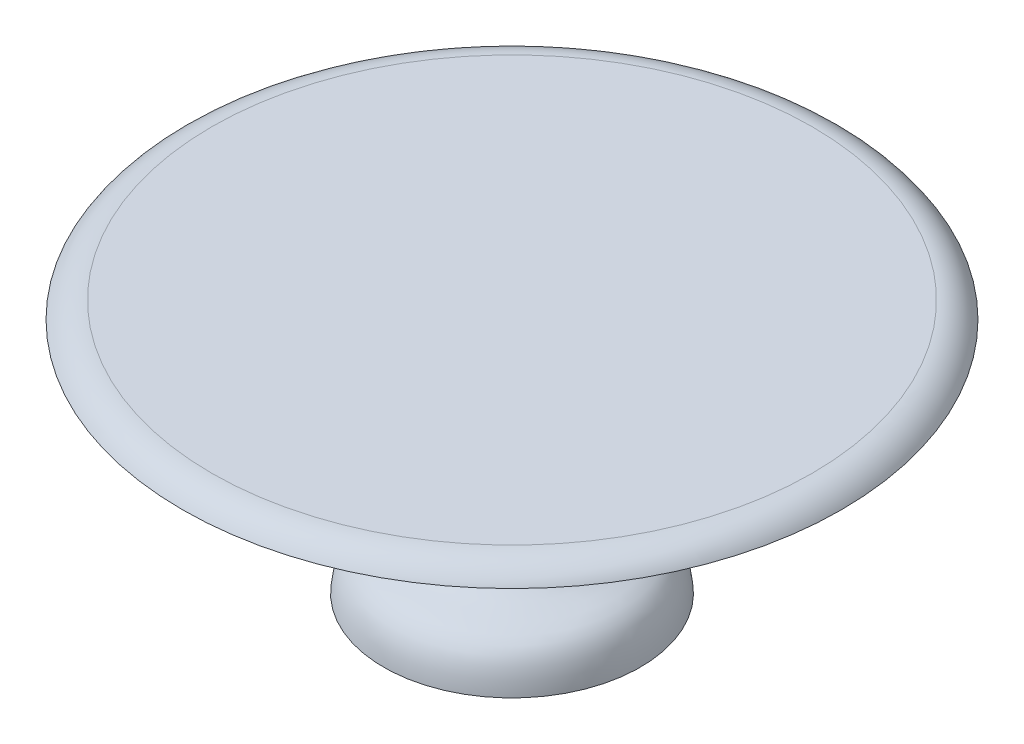
from build123d import *

# Parameters (mm, degrees)
FILLET_1_R = 2


with BuildPart() as part:
    # 草圖2 → 旋轉1 (revolve)
    with BuildSketch(Plane.XY, mode=Mode.PRIVATE) as revolve_1_sk:
        with BuildLine():
            Line((0, 15), (-20, 15))
            Line((-20, 15), (-19.466413941, 14))
            Line((-19.466413941, 14), (-4.949295137, 14))
            add(Edge.make_bspline(
                [(-4.949295137, 14), (-3.439519694, 11.708700289), (-13.638346404, 2.456724966), (-0.305701545, 11.860569474), (-3.888383363, 1.643920034), (-7.332063334, 3.055405181), (-7.582582315, 0)],
                knots=[0, 0, 0, 0, 0.345471571, 0.594733291, 0.813463418, 1, 1, 1, 1], degree=3))
            Line((-7.582582315, 0), (0, 0))
            Line((0, 0), (0, 15))
        make_face()
    revolve(revolve_1_sk.sketch.rotate(Axis((0, 0, 0), (0, 1, 0)), 270), axis=Axis((0, 0, 0), (0, 1, 0)))

    # 圓角1
    # the kernel refuses this fillet: 2 mm, written as the material it takes off along each edge
    with BuildSketch(Plane(origin=(0, 15, 0), x_dir=(0, 0, -1), z_dir=(1, 0, 0))) as fillet_1_piece_1:
        with BuildLine():
            CenterArc((17.734363134, -2), FILLET_1_R, 30, 60)
            Line((19.466413941, -1), (19.501054957, -0.98))
            ThreePointArc((19.501054957, -0.98), (19.768497384, -0.518830473), (20.035290414, -0.018830473))
            Line((20.035290414, -0.018830473), (20, 0.04))
            Line((20, 0.04), (17.734363134, 0.04))
            Line((17.734363134, 0.04), (17.734363134, 0))
        make_face()
    revolve(axis=Axis((0, 15, 0), (0, 1, 0)), mode=Mode.SUBTRACT)


solid = part.part
